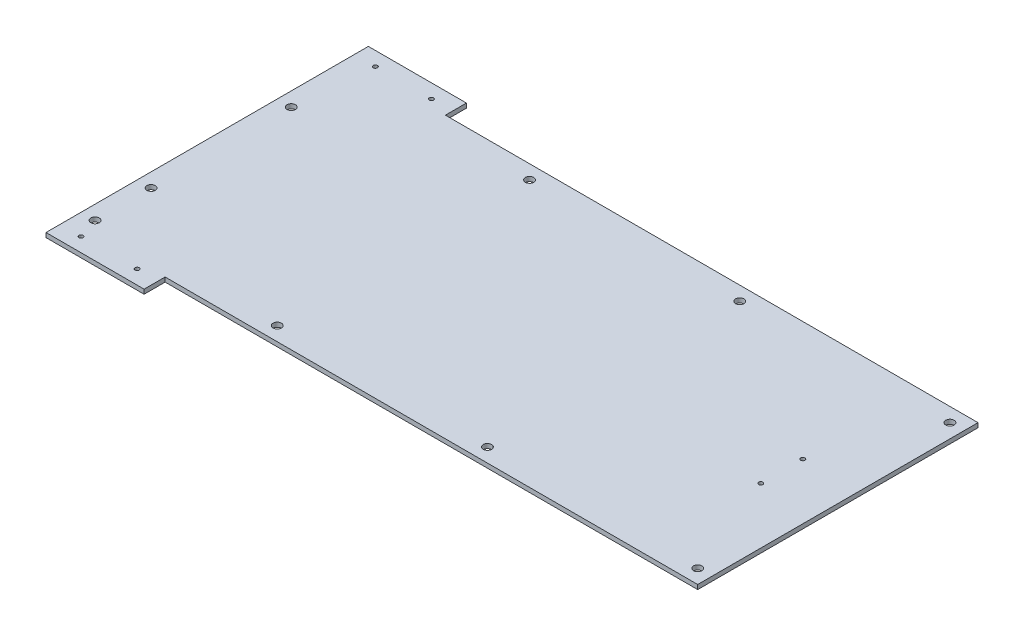
from build123d import *

# Parameters (mm, degrees)
SKETCH1_R           = 1.5
SKETCH1_R_2         = 3
BOSS_EXTRUDE1_DEPTH = 3.175


with BuildPart() as part:
    # Sketch1 → Boss-Extrude1 (new body)
    with BuildSketch(Plane(origin=(0, 0, 0), x_dir=(1, 0, 0), z_dir=(0, 1, 0))):
        Polygon((70, 110.468098835), (450, 110.468098835), (450, 310.468098835), (70, 310.468098835), (70, 325.468098835), (0, 325.468098835), (0, 95.468098835), (70, 95.468098835), align=None)
        with Locations((55, 315.468098835)):
            Circle(SKETCH1_R, mode=Mode.SUBTRACT)
        with Locations((15, 315.468098835)):
            Circle(SKETCH1_R, mode=Mode.SUBTRACT)
        with Locations((55, 105.468098835)):
            Circle(SKETCH1_R, mode=Mode.SUBTRACT)
        with Locations((15, 105.468098835)):
            Circle(SKETCH1_R, mode=Mode.SUBTRACT)
        with Locations((410, 225.468098835)):
            Circle(SKETCH1_R, mode=Mode.SUBTRACT)
        with Locations((410, 195.468098835)):
            Circle(SKETCH1_R, mode=Mode.SUBTRACT)
        with Locations((10, 260.468098835)):
            Circle(SKETCH1_R_2, mode=Mode.SUBTRACT)
        with Locations((440, 300.468098835)):
            Circle(SKETCH1_R_2, mode=Mode.SUBTRACT)
        with Locations((140, 300.468098835)):
            Circle(SKETCH1_R_2, mode=Mode.SUBTRACT)
        with Locations((290, 300.468098835)):
            Circle(SKETCH1_R_2, mode=Mode.SUBTRACT)
        with Locations((440, 120.468098835)):
            Circle(SKETCH1_R_2, mode=Mode.SUBTRACT)
        with Locations((290, 120.468098835)):
            Circle(SKETCH1_R_2, mode=Mode.SUBTRACT)
        with Locations((140, 120.468098835)):
            Circle(SKETCH1_R_2, mode=Mode.SUBTRACT)
        with Locations((10, 120.468098835)):
            Circle(SKETCH1_R_2, mode=Mode.SUBTRACT)
        with Locations((10, 160.468098835)):
            Circle(SKETCH1_R_2, mode=Mode.SUBTRACT)
    extrude(amount=BOSS_EXTRUDE1_DEPTH)


solid = part.part
